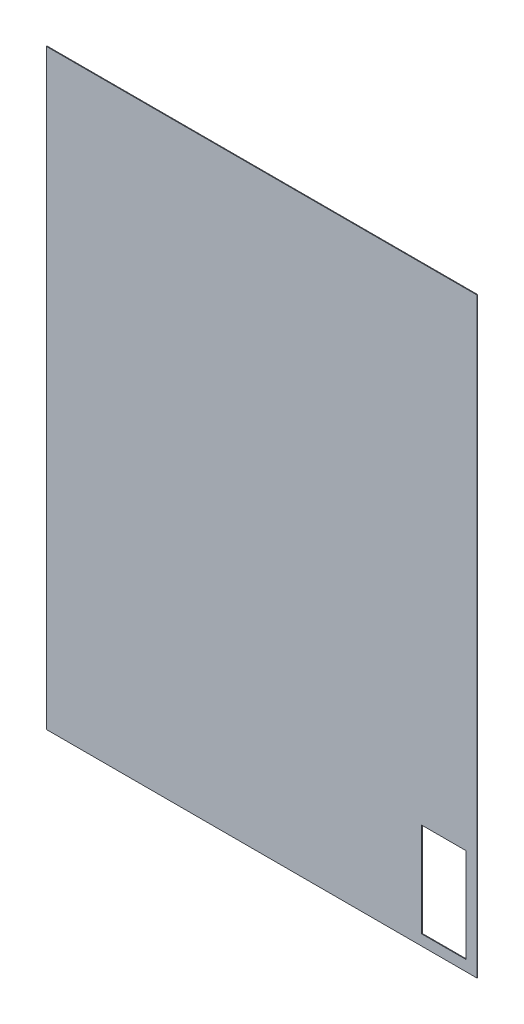
from build123d import *

# Parameters (mm, degrees)
SKETCH1_W           = 1215
SKETCH1_H           = 1670
SKETCH1_W_2         = 126
SKETCH1_H_2         = 266
BOSS_EXTRUDE1_DEPTH = 2


with BuildPart() as part:
    # Sketch1 → Boss-Extrude1 (new body)
    with BuildSketch(Plane.XY):
        with Locations((607.5, 835)):
            Rectangle(SKETCH1_W, SKETCH1_H)
        with Locations((1122, 163)):
            Rectangle(SKETCH1_W_2, SKETCH1_H_2, mode=Mode.SUBTRACT)
    extrude(amount=BOSS_EXTRUDE1_DEPTH)


solid = part.part
